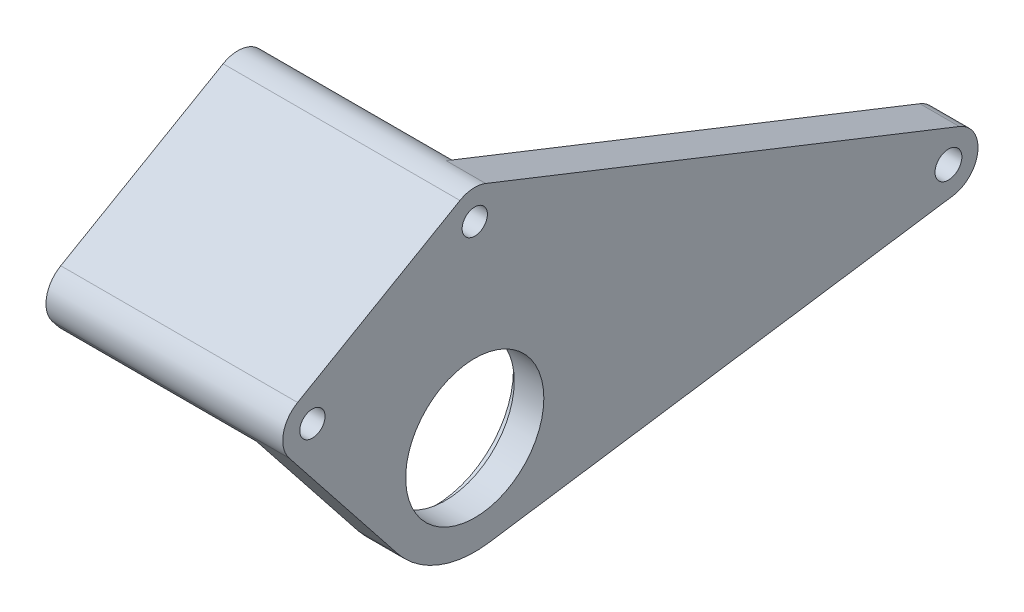
from build123d import *

# Parameters (mm, degrees)
SKETCH1_R           = 2.159
SKETCH1_R_2         = 11.112499999999992
SKETCH1_R_3         = 2.032000000000007
SKETCH1_R_4         = 2.0320000000000227
BOSS_EXTRUDE1_DEPTH = 6.35
SKETCH2_R           = 12.573000000000004
CUT_EXTRUDE1_DEPTH  = 1.5875
BOSS_EXTRUDE2_DEPTH = 31.75
FILLET1_R           = 3.175


with BuildPart() as part:
    # Sketch1 → Boss-Extrude1 (new body)
    with BuildSketch(Plane(origin=(0, 0, 0), x_dir=(0, 0, -1), z_dir=(1, 0, 0))):
        with BuildLine():
            Line((1.7528307479226393, 4.428203994751931), (-74.44716925207737, 34.59070399475192))
            ThreePointArc((-74.44716925207737, 34.59070399475192), (-76.54899129091997, 34.912195919620736), (-78.58125, 34.28694598552338))
            Line((-78.58125, 34.28694598552338), (-104.70274124164806, 19.205695985523498))
            ThreePointArc((-104.70274124164806, 19.205695985523498), (-106.99949191381467, 15.974399461853373), (-106.05477455872966, 12.124224142081344))
            Line((-106.05477455872966, 12.124224142081344), (-88.64427772360533, -9.856752859729227))
            ThreePointArc((-88.64427772360533, -9.856752859729227), (-82.04819337667968, -14.758531743671528), (-73.88489583333335, -15.705283114209777))
            Line((-73.88489583333335, -15.705283114209777), (0.6945312500000005, -4.711584934262932))
            ThreePointArc((0.6945312500000005, -4.711584934262932), (4.730891100411702, -0.5477916082283132), (1.7528307479226393, 4.428203994751931))
        make_face()
        Circle(SKETCH1_R, mode=Mode.SUBTRACT)
        with Locations((-76.2, -9.33e-15)):
            Circle(SKETCH1_R_2, mode=Mode.SUBTRACT)
        with Locations((-76.2, 30.162499999999987)):
            Circle(SKETCH1_R_3, mode=Mode.SUBTRACT)
        with Locations((-102.32149124164806, 15.081250000000113)):
            Circle(SKETCH1_R_4, mode=Mode.SUBTRACT)
    extrude(amount=BOSS_EXTRUDE1_DEPTH)

    # Sketch2 → Cut-Extrude1 (cut)
    with BuildSketch(Plane(origin=(6.35, 0, 0), x_dir=(0, 0, -1), z_dir=(1, 0, 0))):
        with Locations((-76.2, -9.33e-15)):
            Circle(SKETCH2_R)
    extrude(amount=-CUT_EXTRUDE1_DEPTH, mode=Mode.SUBTRACT)

    # Sketch3 → Boss-Extrude2 (add)
    with BuildSketch(Plane(origin=(6.35, 0, 0), x_dir=(0, 0, -1), z_dir=(1, 0, 0))):
        with BuildLine():
            Line((-78.58125000000001, 34.286945985523374), (-104.70274124164803, 19.20569598552344))
            ThreePointArc((-104.70274124164803, 19.20569598552344), (-106.9994919138146, 15.974399461853357), (-106.05477455872966, 12.124224142081344))
            Line((-106.05477455872966, 12.124224142081344), (-101.58067912721546, 6.475620904888487))
            ThreePointArc((-101.58067912721546, 6.475620904888487), (-90.28737650298505, 22.08298807511437), (-71.374, 25.745334782490193))
            Line((-71.374, 25.745334782490193), (-71.374, 29.24533075659958))
            Line((-71.374, 29.24533075659958), (-71.46391508012837, 30.663405062626204))
            ThreePointArc((-71.46391508012837, 30.663405062626204), (-74.0392538140866, 34.40662325104498), (-78.58125000000001, 34.286945985523374))
        make_face()
        Polygon((-76.19999999999999, 33.901997693541205), (-79.4385, 32.03224884677059), (-79.4385, 28.292751153229368), (-76.20000000000002, 26.42300230645877), (-72.9615, 28.292751153229386), (-72.9615, 32.03224884677061), align=None, mode=Mode.SUBTRACT)
        Polygon((-102.32149124164808, 18.820747693541325), (-105.55999124164805, 16.950998846770727), (-105.55999124164805, 13.211501153229527), (-102.32149124164805, 11.341752306458922), (-99.08299124164807, 13.211501153229516), (-99.08299124164807, 16.95099884677072), align=None, mode=Mode.SUBTRACT)
    extrude(amount=BOSS_EXTRUDE2_DEPTH)

    # Fillet1
    fillet1_edges = [part.edges().sort_by_distance(p)[0] for p in [
        (22.225, 25.745334782490197, 71.374),
        (22.225, 6.475620904888487, 101.58067912721546),
    ]]
    fillet(fillet1_edges, radius=FILLET1_R)


with BuildPart() as body_2:
    # Mirror1: mirrored copy
    add(part.part.mirror(Plane(origin=(6.35, 0, 0), x_dir=(0, 0, 1), z_dir=(1, 0, 0))))


solid = body_2.part
